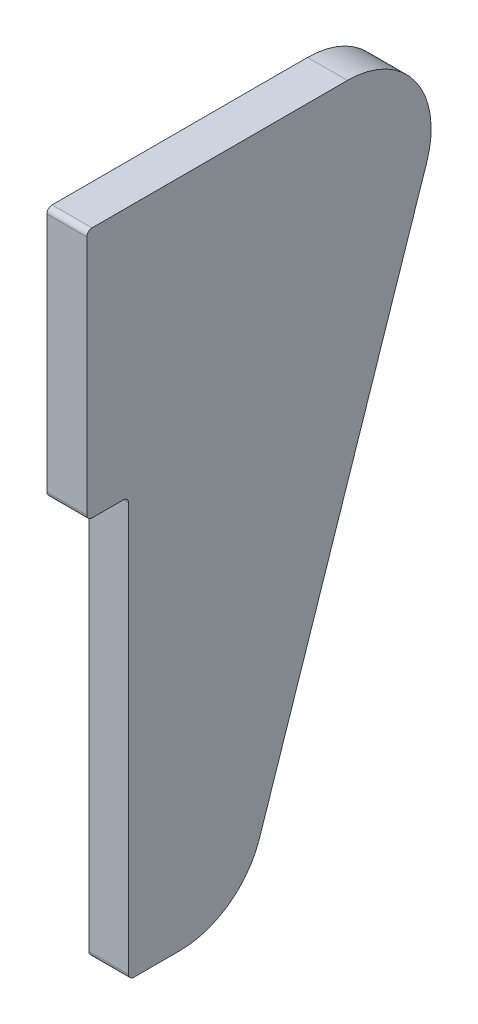
from build123d import *

# Parameters (mm, degrees)
BASE_FLANGE1_DEPTH = 3.0226
FILLET1_R          = 6.35
FILLET2_R          = 0.396875


# Sheet-metal steps are written as plain solids
with BuildPart() as part:
    # Sketch1 → Base-Flange1 (new body)
    with BuildSketch(Plane(origin=(0, 0, 0), x_dir=(0, 0, -1), z_dir=(1, 0, 0))):
        Polygon((0, -19.05), (0, -50.8), (8.466666667, -50.8), (25.4, 0), (0, 0), (-3.175, 0), (-3.175, -19.05), align=None)
    extrude(amount=-BASE_FLANGE1_DEPTH)

    # Fillet1
    fillet1_edges = [part.edges().sort_by_distance(p)[0] for p in [
        (-1.5113, 0, -25.4),
        (-1.5113, -50.8, -8.466666667),
    ]]
    fillet(fillet1_edges, radius=FILLET1_R)

    # Fillet2
    fillet2_edges = [part.edges().sort_by_distance(p)[0] for p in [
        (-1.5113, -50.8, 0),
        (-1.5113, -19.05, 0),
        (-1.5113, -19.05, 3.175),
        (-1.5113, 0, 3.175),
    ]]
    fillet(fillet2_edges, radius=FILLET2_R)


solid = part.part
